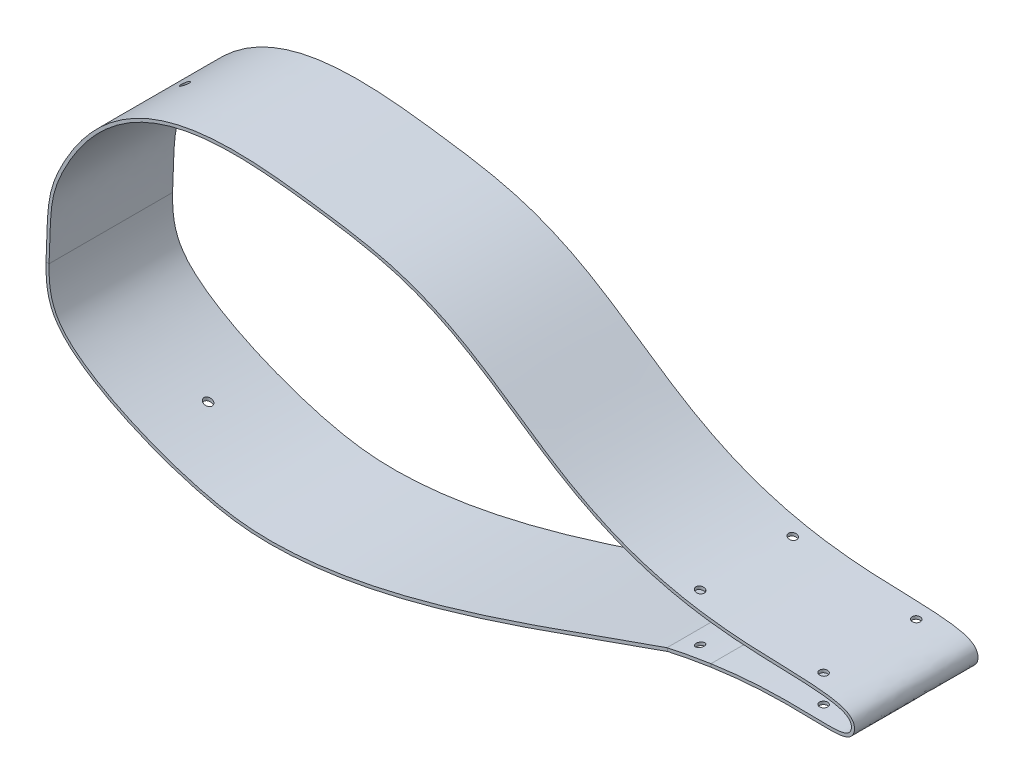
from build123d import *

# Parameters (mm, degrees)
SWEEP1_START            = -40
SWEEP1_DEPTH            = 80
CUT_EXTRUDE2_DEPTH      = 41
CUT_EXTRUDE2_DEPTH_BACK = 10
SKETCH5_R               = 2.65
CUT_EXTRUDE6_DEPTH      = 10
CUT_EXTRUDE6_DEPTH_BACK = 56
SKETCH6_R               = 2.65
SKETCH4_R               = 2.65
CUT_EXTRUDE7_DEPTH      = 120


# Read off the part's stored shape, not the designer's step: Sweep1
with BuildPart() as part:
    # Sweep1 outline → Sweep1 (new body)
    with BuildSketch(Plane.XY.offset(SWEEP1_START)):
        with BuildLine():
            add(Edge.make_bspline(
                [(-27.963356315, 49.796941342), (-23.302208303, 50.838344224), (-20.244110813, 51.461974849), (-14.417424135, 52.585616462), (-12.236316276, 52.992650236), (-6.926934751, 53.9187413), (-3.795362378, 54.439120416), (11.631558424, 56.718914558), (22.660994179, 57.759145131), (42.82117532, 58.800916689), (51.948606231, 58.800227231), (67.701318723, 58.520557974), (74.308488288, 58.235785743), (82.115184797, 58.566972839), (84.368949194, 58.800574273), (87.306016264, 59.587424689), (88.214628543, 59.925198248), (89.875842569, 60.841914525), (90.628802107, 61.428029791), (92.549680859, 63.714603295), (93.130795812, 65.761024786), (92.81772613, 68.773964959), (92.489576425, 69.770143763), (91.422495509, 71.511495296), (90.702090171, 72.259195633), (88.169833275, 74.179153468), (85.978877518, 75.067904638), (80.828215878, 76.472116979), (77.855616581, 76.977432479), (67.822122867, 78.228947694), (59.772813319, 78.641980431), (42.45172814, 79.246003104), (33.19618424, 79.43506197), (10.849768757, 80.651048616), (-1.797042242, 82.091436984), (-25.473646193, 86.328449927), (-36.500266103, 89.123725096), (-57.10737512, 95.893740972), (-66.678282573, 99.864472171), (-84.728196917, 108.703537322), (-93.202314848, 113.569120486), (-109.565159614, 123.819444984), (-117.455535448, 129.204289117), (-133.286464526, 140.030070473), (-141.231235514, 145.472061336), (-166.232667846, 161.089456858), (-184.484750676, 170.550924485), (-222.844444127, 181.079686506), (-240.451691773, 183.8402016), (-274.558451842, 188.341878484), (-290.342017569, 190.177700707), (-322.100406312, 190.531382009), (-338.071914405, 189.044984839), (-368.323608122, 179.964682994), (-382.590212097, 172.352385226), (-401.356739655, 154.773202901), (-407.184341541, 147.878398134), (-415.111156291, 135.935083667), (-417.595599305, 131.731496546), (-421.957932465, 123.401231675), (-423.831837165, 119.285148128), (-427.487025385, 109.487009485), (-428.645873276, 104.159511889), (-430.026662117, 89.773825745), (-430.273208687, 80.733994907), (-430.687129672, 67.178239913), (-430.690147117, 67.07947505), (-430.693164249, 66.98071629)],
                knots=[0.961188218, 0.961188218, 0.961188218, 0.961188218, 0.980110333, 0.980110333, 0.989813278, 0.989813278, 0.999516223, 0.999516223, 1.029252614, 1.029252614, 1.058989004, 1.058989004, 1.088725394, 1.088725394, 1.10359359, 1.10359359, 1.111027687, 1.111027687, 1.118461785, 1.118461785, 1.134391983, 1.134391983, 1.142357082, 1.142357082, 1.150322181, 1.150322181, 1.16625238, 1.16625238, 1.182182578, 1.182182578, 1.215320398, 1.215320398, 1.248458219, 1.248458219, 1.298394147, 1.298394147, 1.348330076, 1.348330076, 1.398266004, 1.398266004, 1.448201933, 1.448201933, 1.498137861, 1.498137861, 1.548073789, 1.548073789, 1.647945646, 1.647945646, 1.716094756, 1.716094756, 1.767377463, 1.767377463, 1.81866017, 1.81866017, 1.869942877, 1.869942877, 1.89558423, 1.89558423, 1.908404907, 1.908404907, 1.921225584, 1.921225584, 1.940986417, 1.940986417, 1.96074725, 1.96074725, 1.960892256, 1.960892256, 1.960892256, 1.960892256], degree=3))
            add(Edge.make_bspline(
                [(-27.963356315, 49.796941342), (-28.016763014, 49.778682686), (-28.070172305, 49.760422303), (-63.661897576, 37.586771773), (-106.606636497, 21.135354012), (-194.436527263, -6.339525191), (-239.293146052, -17.372921155), (-291.104439986, -18.984475708), (-302.996011812, -18.390001037), (-334.606841256, -12.480636871), (-355.570793446, -5.779689935), (-383.845045299, 6.77356718), (-392.738479215, 11.374539937), (-408.179697349, 21.020734128), (-414.729814324, 26.057471363), (-424.321896887, 36.444050375), (-427.230638192, 41.807299486), (-430.430142535, 53.470947671), (-430.783094162, 59.729311134), (-430.693164249, 66.98071629)],
                knots=[-0.000421527, -0.000421527, -0.000421527, -0.000421527, 0, 0, 0.280824208, 0.280824208, 0.561648416, 0.561648416, 0.649787422, 0.649787422, 0.765588741, 0.765588741, 0.8234894, 0.8234894, 0.881390059, 0.881390059, 0.94069503, 0.94069503, 0.999292383, 0.999292383, 0.999292383, 0.999292383], degree=3))
        make_face()
        with BuildLine():
            add(Edge.make_bspline(
                [(-428.714462327, 66.949702804), (-428.303764889, 80.3948563), (-428.056593359, 89.413149914), (-427.061592994, 100.03365178), (-426.624115777, 103.089683339), (-425.385272225, 108.856580979), (-424.584245772, 111.571232133), (-422.126654356, 118.234721275), (-420.295620265, 122.286851644), (-416.017214184, 130.501120541), (-413.57346693, 134.65424996), (-405.788440164, 146.439108877), (-400.07979947, 153.225468467), (-381.710405909, 170.527508921), (-367.765263419, 178.025789495), (-338.040880365, 187.027537517), (-322.273665735, 188.534054401), (-290.790012961, 188.223567515), (-275.084217891, 186.41209718), (-241.026832657, 181.924458691), (-223.495851802, 179.18163084), (-185.506936788, 168.81512231), (-167.441106914, 159.49188564), (-142.567855948, 143.983241163), (-134.643571555, 138.560968532), (-118.812608363, 127.735155663), (-110.901731632, 122.330775909), (-94.461898195, 112.014768477), (-85.93107558, 107.103475651), (-67.742169042, 98.168813005), (-58.089212599, 94.148693715), (-37.310652399, 87.29275027), (-26.195081309, 84.460965926), (-2.349272823, 80.167117233), (10.377735923, 78.706139834), (32.844878716, 77.465544274), (42.110835369, 77.275181817), (59.395406452, 76.67782451), (67.399338025, 76.271019926), (80.481097799, 74.670609063), (85.63962849, 73.489323358), (89.877913704, 70.451225682), (90.710499645, 69.227549932), (91.133719043, 66.33240394), (90.738508824, 64.748275698), (88.205381576, 61.451638022), (84.755785456, 60.683469683), (74.667222492, 60.209924471), (68.050949075, 60.489896621), (52.252551698, 60.777132197), (43.07064768, 60.786195368), (22.791543238, 59.755773498), (11.69568679, 58.718877126), (-3.816362708, 56.43912156), (-6.964819609, 55.918432285), (-12.302425948, 54.991607166), (-14.494899171, 54.584141285), (-20.450602224, 53.440169705), (-23.582572388, 52.802809442), (-28.481613861, 51.708538292), (-28.491708565, 51.706283405), (-28.501802738, 51.704028568)],
                knots=[1.1712e-05, 1.1712e-05, 1.1712e-05, 1.1712e-05, 0.019759953, 0.019759953, 0.02963993, 0.02963993, 0.039519906, 0.039519906, 0.052340012, 0.052340012, 0.065160118, 0.065160118, 0.090800329, 0.090800329, 0.142080752, 0.142080752, 0.193361175, 0.193361175, 0.244641599, 0.244641599, 0.312787673, 0.312787673, 0.412655082, 0.412655082, 0.462588787, 0.462588787, 0.512522491, 0.512522491, 0.562456196, 0.562456196, 0.6123899, 0.6123899, 0.662323605, 0.662323605, 0.712257309, 0.712257309, 0.745393654, 0.745393654, 0.778529999, 0.778529999, 0.810388976, 0.810388976, 0.826318465, 0.826318465, 0.842247954, 0.842247954, 0.87198302, 0.87198302, 0.901718086, 0.901718086, 0.931453152, 0.931453152, 0.961188218, 0.961188218, 0.970890923, 0.970890923, 0.980593628, 0.980593628, 0.999999038, 0.999999038, 1.000039109, 1.000039109, 1.000039109, 1.000039109], degree=3))
            add(Edge.make_bspline(
                [(-28.501802738, 51.704028568), (-99.635704645, 27.382632982), (-200.283010418, -14.085551917), (-290.775911461, -17.009002048), (-302.494532532, -16.447812481), (-351.52750723, -7.363134979), (-399.47031424, 12.67172789), (-427.222057845, 42.390949451), (-428.89348718, 52.341848723), (-428.714635292, 66.935611895), (-428.714548855, 66.942656995), (-428.714462327, 66.949702804)],
                knots=[3.5256e-05, 3.5256e-05, 3.5256e-05, 3.5256e-05, 0.561648416, 0.561648416, 0.649787422, 0.649787422, 0.881390059, 0.881390059, 1, 1, 1.000057279, 1.000057279, 1.000057279, 1.000057279], degree=3))
        make_face(mode=Mode.SUBTRACT)
    extrude(amount=SWEEP1_DEPTH)

    # Sketch5 → Cut-Extrude2 (cut, two sides: drawn at the far end of the back side and taken through both)
    with BuildSketch(Plane(origin=(0, 0, 0), x_dir=(1, 0, 0), z_dir=(0, 1, 0)).offset(-CUT_EXTRUDE2_DEPTH_BACK)):
        with Locations(Location((-365.693155522, 0, 0), (0, 0, 90))):
            Circle(SKETCH5_R)
    extrude(amount=CUT_EXTRUDE2_DEPTH + CUT_EXTRUDE2_DEPTH_BACK, mode=Mode.SUBTRACT)

    # Sketch6 → Cut-Extrude6 (cut, two sides: drawn at the far end of the back side and taken through both)
    with BuildSketch(Plane(origin=(0, 170, 0), x_dir=(1, 0, 0), z_dir=(0, 1, 0)).offset(-CUT_EXTRUDE6_DEPTH_BACK)):
        with Locations(Location((-380.693155522, 0, 0), (0, 0, 90))):
            Circle(SKETCH6_R)
    extrude(amount=CUT_EXTRUDE6_DEPTH + CUT_EXTRUDE6_DEPTH_BACK, mode=Mode.SUBTRACT)

    # Sketch4 → Cut-Extrude7 (cut)
    with BuildSketch(Plane(origin=(0, 0, 0), x_dir=(1, 0, 0), z_dir=(0, 1, 0))):
        with Locations(Location((62.963589611, -30, 0), (0, 0, 90))):
            Circle(SKETCH4_R)
        with Locations(Location((-17.036410389, -30, 0), (0, 0, 90))):
            Circle(SKETCH4_R)
        with Locations(Location((-17.036410389, 30, 0), (0, 0, 90))):
            Circle(SKETCH4_R)
        with Locations(Location((62.963589611, 30, 0), (0, 0, 90))):
            Circle(SKETCH4_R)
    extrude(amount=CUT_EXTRUDE7_DEPTH, mode=Mode.SUBTRACT)


solid = part.part
